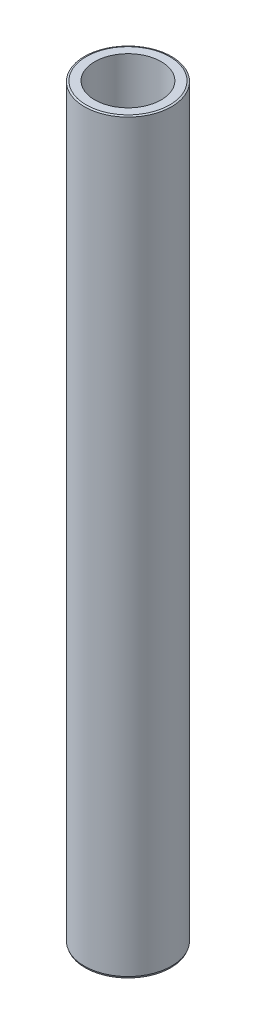
from build123d import *
from OCP.BRepFilletAPI import BRepFilletAPI_MakeChamfer

# Parameters (mm, degrees)
SKETCH1_R           = 35
BOSS_EXTRUDE1_DEPTH = 600
SKETCH2_R           = 26.683207558
CUT_EXTRUDE1_DEPTH  = 603.038204768
CHAMFER1_SIZE       = 0.561981239
CHAMFER1_SIZE2      = 1.419039024


with BuildPart() as part:
    # Sketch1 → Boss-Extrude1 (new body)
    with BuildSketch(Plane(origin=(0, 0, 0), x_dir=(1, 0, 0), z_dir=(0, 1, 0))):
        Circle(SKETCH1_R)
    extrude(amount=BOSS_EXTRUDE1_DEPTH)

    # Sketch2 → Cut-Extrude1 (cut, through all)
    with BuildSketch(Plane(origin=(0, 0, 0), x_dir=(1, 0, 0), z_dir=(0, 1, 0))):
        Circle(SKETCH2_R)
    extrude(amount=CUT_EXTRUDE1_DEPTH, mode=Mode.SUBTRACT)

    # Chamfer1: one chamfer whose edges measure the first distance from different faces: ONE call of the kernel's chamfer builder (chamfer() names one face for all edges)
    chamfer1_edges_1 = [part.edges().sort_by_distance(p)[0] for p in [
        (-35, 600, 0),
    ]]
    chamfer1_side_1 = [part.faces().sort_by_distance(p)[0] for p in [
        (-35, 300, 0),
    ]]
    chamfer1_edges_2 = [part.edges().sort_by_distance(p)[0] for p in [
        (-35, 0, 0),
    ]]
    chamfer1_side_2 = [part.faces().sort_by_distance(p)[0] for p in [
        (-34.010050506, 0, 0),
    ]]
    chamfer1 = BRepFilletAPI_MakeChamfer(part.part.solid().wrapped)
    for e in chamfer1_edges_1:
        chamfer1.Add(CHAMFER1_SIZE, CHAMFER1_SIZE2, e.wrapped, chamfer1_side_1[0].wrapped)  # the first distance lies on this face
    for e in chamfer1_edges_2:
        chamfer1.Add(CHAMFER1_SIZE, CHAMFER1_SIZE2, e.wrapped, chamfer1_side_2[0].wrapped)  # the first distance lies on this face
    add(Compound.cast(chamfer1.Shape()), mode=Mode.REPLACE)


solid = part.part
